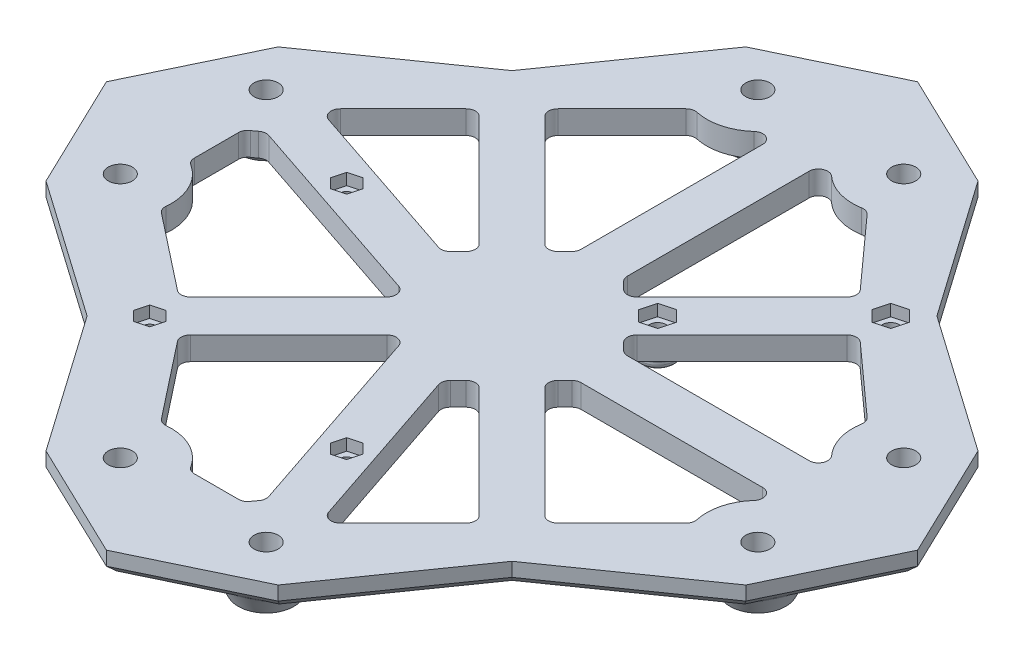
from build123d import *

# Parameters (mm, degrees)
SKETCH1_R           = 2.6
BOSS_EXTRUDE1_DEPTH = 5
CIRPATTERN1_COUNT   = 4
CHAMFER1_SIZE       = 2
SKETCH5_R           = 1.375
CUT_EXTRUDE1_DEPTH  = 10
CUT_EXTRUDE2_DEPTH  = 2.5
SKETCH7_R           = 1.8
CUT_EXTRUDE3_DEPTH  = 10
CUT_EXTRUDE4_DEPTH  = 2.5
BOSS_EXTRUDE2_START = 2.5
SKETCH9_R           = 3.8
SKETCH9_R_2         = 1.8
BOSS_EXTRUDE2_DEPTH = 2.5
FILLET1_R           = 1
FILLET2_R           = 1
CUT_EXTRUDE5_DEPTH  = 2.5
BOSS_EXTRUDE3_DEPTH = 4
CHAMFER3_SIZE       = 2.5
FILLET4_R           = 1
CUT_EXTRUDE6_DEPTH  = 124.632678512


with BuildPart() as part:
    # Sketch1 → Boss-Extrude1 (new body)
    with BuildSketch(Plane(origin=(0, 0, 0), x_dir=(1, 0, 0), z_dir=(0, 1, 0))):
        Polygon((-25.000397559, 75.352774368), (0, 87.349983289), (25.000397559, 75.352774368), (45.752697693, 45.752697693), (75.352774368, 25.000397559), (87.349983289, 0), (75.352774368, -25.000397559), (45.752697693, -45.752697693), (25.000397559, -75.352774368), (0, -87.349983289), (-25.000397559, -75.352774368), (-45.752697693, -45.752697693), (-75.352774368, -25.000397559), (-87.349983289, 0), (-75.352774368, 25.000397559), (-45.752697693, 45.752697693), align=None)
        with Locations(Location((-15.705, 68.65, 0), (0, 0, 270))):
            Circle(SKETCH1_R, mode=Mode.SUBTRACT)
        with Locations(Location((15.705, 68.65, 0), (0, 0, 270))):
            Circle(SKETCH1_R, mode=Mode.SUBTRACT)
        with Locations(Location((68.65, 15.705, 0), (0, 0, 270))):
            Circle(SKETCH1_R, mode=Mode.SUBTRACT)
        with Locations(Location((68.65, -15.705, 0), (0, 0, 270))):
            Circle(SKETCH1_R, mode=Mode.SUBTRACT)
        with Locations(Location((15.705, -68.65, 0), (0, 0, 270))):
            Circle(SKETCH1_R, mode=Mode.SUBTRACT)
        with Locations(Location((-15.705, -68.65, 0), (0, 0, 270))):
            Circle(SKETCH1_R, mode=Mode.SUBTRACT)
        with Locations(Location((-68.65, -15.705, 0), (0, 0, 270))):
            Circle(SKETCH1_R, mode=Mode.SUBTRACT)
        with Locations(Location((-68.65, 15.705, 0), (0, 0, 270))):
            Circle(SKETCH1_R, mode=Mode.SUBTRACT)
    extrude(amount=BOSS_EXTRUDE1_DEPTH)

    # Sketch4 → Revolve1 (revolve)
    with BuildSketch(Plane(origin=(14.012041645, 0, -6.724108712), x_dir=(0, -1, 0), z_dir=(0.901565003925945, 0, -0.432643668272183)), mode=Mode.PRIVATE) as revolve1_sk:
        Polygon((0, 73.18710633), (4, 73.18710633), (4, 74.68710633), (0, 76.68710633), align=None)
    revolve1 = revolve(revolve1_sk.sketch.rotate(Axis((-15.705, 5, -68.65), (0, -1, 0)), 205.63545134), axis=Axis((-15.705, 5, -68.65), (0, -1, 0)))

    # Mirror1: Revolve1 across plane
    add(revolve1.mirror(Plane(origin=(0, 0, 0), x_dir=(0, 0, 1), z_dir=(1, 0, 0))))

    # CirPattern1: Revolve1 ×4 about axis
    cirpattern1_axis = Axis((0, 0, 0), (0, 1, 0))
    for i in range(1, CIRPATTERN1_COUNT):
        add(revolve1.rotate(cirpattern1_axis, i * 360 / CIRPATTERN1_COUNT))

    # CirPattern1 copy 1 sketch → CirPattern1 copy 1 (revolve)
    with BuildSketch(Plane(origin=(-6.724108712, 0, 14.012041645), x_dir=(0, -1, 0), z_dir=(-0.432643668272162, 0, 0.9015650039259551))):
        Polygon((0, -73.18710633), (4, -73.18710633), (4, -74.68710633), (0, -76.68710633), align=None)
    revolve(axis=Axis((-68.65, 5, -15.705), (0, 1, 0)))

    # CirPattern1 copy 2 sketch → CirPattern1 copy 2 (revolve)
    with BuildSketch(Plane(origin=(14.012041645, 0, 6.724108712), x_dir=(0, -1, 0), z_dir=(0.901565003925955, 0, 0.43264366827216205))):
        Polygon((0, -73.18710633), (4, -73.18710633), (4, -74.68710633), (0, -76.68710633), align=None)
    revolve(axis=Axis((-15.705, 5, 68.65), (0, 1, 0)))

    # CirPattern1 copy 3 sketch → CirPattern1 copy 3 (revolve)
    with BuildSketch(Plane(origin=(6.724108712, 0, -14.012041645), x_dir=(0, -1, 0), z_dir=(0.4326436682721621, 0, -0.901565003925955))):
        Polygon((0, -73.18710633), (4, -73.18710633), (4, -74.68710633), (0, -76.68710633), align=None)
    revolve(axis=Axis((68.65, 5, 15.705), (0, 1, 0)))

    # Chamfer1
    chamfer1_edges = [part.edges().sort_by_distance(p)[0] for p in [
        (35.376547626, 0, -60.55273603),
        (60.55273603, 0, -35.376547626),
        (81.351378828, 0, -12.500198779),
        (81.351378828, 0, 12.500198779),
        (60.55273603, 0, 35.376547626),
        (35.376547626, 0, 60.55273603),
        (12.500198779, 0, 81.351378828),
        (-12.500198779, 0, 81.351378828),
        (-35.376547626, 0, 60.55273603),
        (-60.55273603, 0, 35.376547626),
        (-81.351378828, 0, 12.500198779),
        (-81.351378828, 0, -12.500198779),
        (-60.55273603, 0, -35.376547626),
        (-35.376547626, 0, -60.55273603),
        (-12.500198779, 0, -81.351378828),
        (12.500198779, 0, -81.351378828),
    ]]
    chamfer(chamfer1_edges, length=CHAMFER1_SIZE)

    # Sketch5 → Cut-Extrude1 (cut)
    with BuildSketch(Plane.XZ):
        with Locations(Location((-39.013516254, 39.013516254, 0), (0, 0, 270))):
            Circle(SKETCH5_R)
        with Locations(Location((-42.54905016, -6.948424523, 0), (0, 0, 270))):
            Circle(SKETCH5_R)
        with Locations(Location((6.948424523, 42.54905016, 0), (0, 0, 270))):
            Circle(SKETCH5_R)
    extrude(amount=-CUT_EXTRUDE1_DEPTH, mode=Mode.SUBTRACT)

    # Sketch6 → Cut-Extrude2 (cut)
    with BuildSketch(Plane(origin=(0, 5, 0), x_dir=(1, 0, 0), z_dir=(0, 1, 0))):
        Polygon((-41.801903933, 9.736812202), (-44.590291613, 8.989665975), (-45.337437839, 6.201278296), (-43.296196387, 4.160036844), (-40.507808708, 4.90718307), (-39.760662481, 7.69557075), align=None)
        Polygon((-38.266370027, -36.225128575), (-41.054757707, -36.972274802), (-41.801903933, -39.760662481), (-39.760662481, -41.801903933), (-36.972274802, -41.054757707), (-36.225128575, -38.266370028), align=None)
        Polygon((7.69557075, -39.760662481), (4.907183071, -40.507808708), (4.160036844, -43.296196387), (6.201278296, -45.337437839), (8.989665975, -44.590291613), (9.736812202, -41.801903933), align=None)
    extrude(amount=-CUT_EXTRUDE2_DEPTH, mode=Mode.SUBTRACT)

    # Sketch7 → Cut-Extrude3 (cut)
    with BuildSketch(Plane.XZ):
        with Locations(Location((40.781283207, -40.781283207, 0), (0, 0, 270))):
            Circle(SKETCH7_R)
        with Locations(Location((15.678992475, -15.678992475, 0), (0, 0, 270))):
            Circle(SKETCH7_R)
    extrude(amount=-CUT_EXTRUDE3_DEPTH, mode=Mode.SUBTRACT)

    # Sketch8 → Cut-Extrude4 (cut)
    with BuildSketch(Plane(origin=(0, 5, 0), x_dir=(1, 0, 0), z_dir=(0, 1, 0))):
        Polygon((16.538210636, 18.885638306), (13.331564805, 18.026420145), (12.472346644, 14.819774314), (14.819774314, 12.472346644), (18.026420145, 13.331564805), (18.885638306, 16.538210636), align=None)
        Polygon((41.640501368, 43.987929038), (38.433855537, 43.128710877), (37.574637376, 39.922065046), (39.922065046, 37.574637376), (43.128710877, 38.433855537), (43.987929038, 41.640501368), align=None)
    extrude(amount=-CUT_EXTRUDE4_DEPTH, mode=Mode.SUBTRACT)

    # Sketch9 → Boss-Extrude2 (add)
    # profile 1 of 2: a face of its own
    with BuildSketch(Plane.XZ.offset(BOSS_EXTRUDE2_START)):
        with Locations(Location((15.678992475, -15.678992475, 0), (0, 0, 270))):
            Circle(SKETCH9_R)
        with Locations(Location((15.678992475, -15.678992475, 0), (0, 0, 270))):
            Circle(SKETCH9_R_2, mode=Mode.SUBTRACT)
    # profile 2 of 2: a face of its own
    with BuildSketch(Plane.XZ.offset(BOSS_EXTRUDE2_START)):
        with Locations(Location((40.781283207, -40.781283207, 0), (0, 0, 270))):
            Circle(SKETCH9_R)
        with Locations(Location((40.781283207, -40.781283207, 0), (0, 0, 270))):
            Circle(SKETCH9_R_2, mode=Mode.SUBTRACT)
    extrude(amount=-BOSS_EXTRUDE2_DEPTH)

    # Fillet1
    fillet1_edges = [part.edges().sort_by_distance(p)[0] for p in [
        (15.678992475, -2.5, -11.878992475),
        (15.678992475, 0, -11.878992475),
        (15.678992475, -2.5, -13.878992475),
        (40.781283207, -2.5, -36.981283207),
        (40.781283207, 0, -36.981283207),
    ]]
    fillet(fillet1_edges, radius=FILLET1_R - 0.0001)  # a hair under: the kernel refuses the full size

    # Fillet2
    fillet2_edges = [part.edges().sort_by_distance(p)[0] for p in [
        (-76.65, 0, 15.705),
        (61.437479969, 0, 12.243850654),
        (-12.243850654, 0, 61.437479969),
        (-61.437479969, 0, -12.243850654),
        (-15.705, 0, -76.65),
        (15.705, 0, -76.65),
        (76.65, 0, -15.705),
        (15.705, 0, 76.65),
    ]]
    fillet(fillet2_edges, radius=FILLET2_R)

    # Sketch10 → Cut-Extrude5 (cut)
    with BuildSketch(Plane.XZ):
        Polygon((-12.727922061, 0), (0, 12.727922061), (12.727922061, 0), (0, -12.727922061), align=None)
    extrude(amount=-CUT_EXTRUDE5_DEPTH, mode=Mode.SUBTRACT)

    # Sketch11 → Boss-Extrude3 (add)
    with BuildSketch(Plane.XZ):
        Polygon((18.384776311, 0), (0, 18.384776311), (-18.384776311, 0), (0, -18.384776311), align=None)
        Polygon((0, 12.727922061), (-12.727922061, 0), (0, -12.727922061), (12.727922061, 0), align=None, mode=Mode.SUBTRACT)
    extrude(amount=BOSS_EXTRUDE3_DEPTH)

    # Chamfer3
    chamfer3_edges = [part.edges().sort_by_distance(p)[0] for p in [
        (9.192388155, -4, -9.192388155),
        (9.192388155, -4, 9.192388155),
        (-9.192388155, -4, 9.192388155),
        (-9.192388155, -4, -9.192388155),
    ]]
    chamfer(chamfer3_edges, length=CHAMFER3_SIZE)

    # Fillet4
    fillet4_edges = [part.edges().sort_by_distance(p)[0] for p in [
        (9.192388155, 0, -9.192388155),
        (9.192388155, 0, 9.192388155),
        (-9.192388155, 0, 9.192388155),
        (-9.192388155, 0, -9.192388155),
    ]]
    fillet(fillet4_edges, radius=FILLET4_R)

    # Sketch12 → Cut-Extrude6 (cut, through all)
    with BuildSketch(Plane.XZ):
        with BuildLine():
            Line((-56.948550896, 18.546846032), (-40.806267941, 31.242436638))
            ThreePointArc((-40.806267941, 31.242436638), (-39.450994993, 31.666848742), (-38.155666668, 31.084598856))
            Line((-38.155666668, 31.084598856), (-17.012921431, 9.941853619))
            ThreePointArc((-17.012921431, 9.941853619), (-16.480192522, 8.070021205), (-17.791002352, 6.631503125))
            Line((-17.791002352, 6.631503125), (-59.854761908, -7.480415701))
            ThreePointArc((-59.854761908, -7.480415701), (-60.843844033, -7.552889107), (-61.746141541, -7.141312805))
            ThreePointArc((-61.746141541, -7.141312805), (-62.226839749, -6.77510569), (-62.726923077, -6.435849027))
            ThreePointArc((-62.726923077, -6.435849027), (-63.404116039, -5.711317773), (-63.65, -4.75054885))
            Line((-63.65, -4.75054885), (-63.65, 4.75054885))
            ThreePointArc((-63.65, 4.75054885), (-63.404116039, 5.711317773), (-62.726923077, 6.435849027))
            ThreePointArc((-62.726923077, 6.435849027), (-58.755520314, 10.898829826), (-57.702599618, 16.779441659))
            ThreePointArc((-57.702599618, 16.779441659), (-57.55173598, 17.759633481), (-56.948550896, 18.546846032))
        make_face()
        with BuildLine():
            Line((-7.071067812, -16.970562748), (-5.585786438, -18.455844123))
            ThreePointArc((-5.585786438, -18.455844123), (-5.152240935, -19.10469082), (-5, -19.870057685))
            Line((-5, -19.870057685), (-5, -58.994795445))
            ThreePointArc((-5, -58.994795445), (-6.187122869, -60.822151669), (-8.339230769, -60.48021153))
            ThreePointArc((-8.339230769, -60.48021153), (-12.893578594, -58.015343932), (-18.071031651, -57.907472633))
            ThreePointArc((-18.071031651, -57.907472633), (-19.06220035, -57.873999406), (-19.915432786, -57.368499402))
            Line((-19.915432786, -57.368499402), (-33.692218626, -43.591713562))
            ThreePointArc((-33.692218626, -43.591713562), (-34.278005063, -42.1775), (-33.692218626, -40.763286438))
            Line((-33.692218626, -40.763286438), (-9.899494937, -16.970562748))
            ThreePointArc((-9.899494937, -16.970562748), (-8.485281374, -16.384776311), (-7.071067812, -16.970562748))
        make_face()
        with BuildLine():
            Line((9.899494937, -16.970562748), (32.550182536, -39.621250348))
            ThreePointArc((32.550182536, -39.621250348), (33.135274867, -40.982776671), (32.622704796, -42.373229434))
            Line((32.622704796, -42.373229434), (19.315403986, -57.162398725))
            ThreePointArc((19.315403986, -57.162398725), (18.489979969, -57.712135969), (17.501949985, -57.797766555))
            ThreePointArc((17.501949985, -57.797766555), (12.614398973, -58.093097742), (8.339230769, -60.48021153))
            ThreePointArc((8.339230769, -60.48021153), (6.187122869, -60.822151669), (5, -58.994795445))
            Line((5, -58.994795445), (5, -19.870057685))
            ThreePointArc((5, -19.870057685), (5.152240935, -19.10469082), (5.585786438, -18.455844123))
            Line((5.585786438, -18.455844123), (7.071067812, -16.970562748))
            ThreePointArc((7.071067812, -16.970562748), (8.485281374, -16.384776311), (9.899494937, -16.970562748))
        make_face()
        with BuildLine():
            Line((-56.34485723, -16.850643543), (-20.713372671, -4.896680724))
            ThreePointArc((-20.713372671, -4.896680724), (-19.619621178, -4.845875184), (-18.663026467, -5.378604093))
            Line((-18.663026467, -5.378604093), (-16.970562748, -7.071067812))
            ThreePointArc((-16.970562748, -7.071067812), (-16.384776311, -8.485281374), (-16.970562748, -9.899494937))
            Line((-16.970562748, -9.899494937), (-40.763286438, -33.692218626))
            ThreePointArc((-40.763286438, -33.692218626), (-42.1775, -34.278005063), (-43.591713562, -33.692218626))
            Line((-43.591713562, -33.692218626), (-57.122938152, -20.160994036))
            ThreePointArc((-57.122938152, -20.160994036), (-57.655667061, -18.289161622), (-56.34485723, -16.850643543))
        make_face()
        with BuildLine():
            Line((42.373229434, -32.622704796), (57.162398725, -19.315403986))
            ThreePointArc((57.162398725, -19.315403986), (57.712135969, -18.489979969), (57.797766555, -17.501949985))
            ThreePointArc((57.797766555, -17.501949985), (58.093097742, -12.614398973), (60.48021153, -8.339230769))
            ThreePointArc((60.48021153, -8.339230769), (60.822151669, -6.187122869), (58.994795445, -5))
            Line((58.994795445, -5), (19.870057685, -5))
            ThreePointArc((19.870057685, -5), (19.10469082, -5.152240935), (18.455844123, -5.585786438))
            Line((18.455844123, -5.585786438), (16.970562748, -7.071067812))
            ThreePointArc((16.970562748, -7.071067812), (16.384776311, -8.485281374), (16.970562748, -9.899494937))
            Line((16.970562748, -9.899494937), (39.621250348, -32.550182536))
            ThreePointArc((39.621250348, -32.550182536), (40.982776671, -33.135274867), (42.373229434, -32.622704796))
        make_face()
        with BuildLine():
            Line((19.870057685, 5), (58.994795445, 5))
            ThreePointArc((58.994795445, 5), (60.822151669, 6.187122869), (60.48021153, 8.339230769))
            ThreePointArc((60.48021153, 8.339230769), (58.015343932, 12.893578594), (57.907472633, 18.071031651))
            ThreePointArc((57.907472633, 18.071031651), (57.873999406, 19.06220035), (57.368499402, 19.915432786))
            Line((57.368499402, 19.915432786), (43.591713562, 33.692218626))
            ThreePointArc((43.591713562, 33.692218626), (42.1775, 34.278005063), (40.763286438, 33.692218626))
            Line((40.763286438, 33.692218626), (16.970562748, 9.899494937))
            ThreePointArc((16.970562748, 9.899494937), (16.384776311, 8.485281374), (16.970562748, 7.071067812))
            Line((16.970562748, 7.071067812), (18.455844123, 5.585786438))
            ThreePointArc((18.455844123, 5.585786438), (19.10469082, 5.152240935), (19.870057685, 5))
        make_face()
        with BuildLine():
            Line((16.850643543, 56.34485723), (4.896680724, 20.713372671))
            ThreePointArc((4.896680724, 20.713372671), (4.845875184, 19.619621178), (5.378604093, 18.663026467))
            Line((5.378604093, 18.663026467), (7.071067812, 16.970562748))
            ThreePointArc((7.071067812, 16.970562748), (8.485281374, 16.384776311), (9.899494937, 16.970562748))
            Line((9.899494937, 16.970562748), (33.692218626, 40.763286438))
            ThreePointArc((33.692218626, 40.763286438), (34.278005063, 42.1775), (33.692218626, 43.591713562))
            Line((33.692218626, 43.591713562), (20.160994036, 57.122938152))
            ThreePointArc((20.160994036, 57.122938152), (18.289161622, 57.655667061), (16.850643543, 56.34485723))
        make_face()
        with BuildLine():
            Line((-4.75054885, 63.65), (4.75054885, 63.65))
            ThreePointArc((4.75054885, 63.65), (5.711317773, 63.404116039), (6.435849027, 62.726923077))
            ThreePointArc((6.435849027, 62.726923077), (6.77510569, 62.226839749), (7.141312805, 61.746141541))
            ThreePointArc((7.141312805, 61.746141541), (7.552889107, 60.843844033), (7.480415701, 59.854761908))
            Line((7.480415701, 59.854761908), (-6.631503125, 17.791002352))
            ThreePointArc((-6.631503125, 17.791002352), (-8.070021205, 16.480192522), (-9.941853619, 17.012921431))
            Line((-9.941853619, 17.012921431), (-31.084598856, 38.155666668))
            ThreePointArc((-31.084598856, 38.155666668), (-31.666848742, 39.450994993), (-31.242436638, 40.806267941))
            Line((-31.242436638, 40.806267941), (-18.546846032, 56.948550896))
            ThreePointArc((-18.546846032, 56.948550896), (-17.759633481, 57.55173598), (-16.779441659, 57.702599618))
            ThreePointArc((-16.779441659, 57.702599618), (-10.898829826, 58.755520314), (-6.435849027, 62.726923077))
            ThreePointArc((-6.435849027, 62.726923077), (-5.711317773, 63.404116039), (-4.75054885, 63.65))
        make_face()
    extrude(amount=-CUT_EXTRUDE6_DEPTH, mode=Mode.SUBTRACT)


solid = part.part
